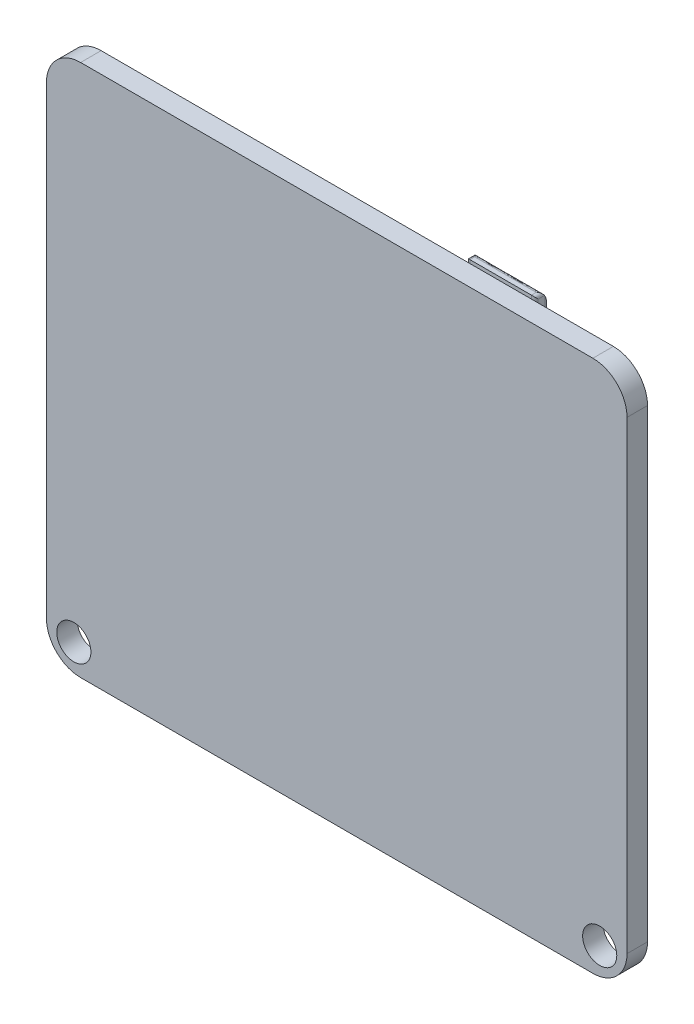
from build123d import *

# Parameters (mm, degrees)
SKETCH2_W           = 85
SKETCH2_H           = 78
BOSS_EXTRUDE2_DEPTH = 3
SKETCH5_R           = 2.5
CUT_EXTRUDE1_DEPTH  = 3
FILLET1_R           = 5
FILLET2_R           = 5
FILLET3_R           = 5
FILLET4_R           = 5
SKETCH12_W          = 10
SKETCH12_H          = 2.5
BOSS_EXTRUDE3_DEPTH = 3
SKETCH14_W          = 10
SKETCH14_H          = 2
BOSS_EXTRUDE4_DEPTH = 1.5
FILLET10_R          = 0.5
FILLET11_START      = 47
FILLET11_DEPTH      = 11


with BuildPart() as part:
    # Sketch2 → Boss-Extrude2 (new body)
    with BuildSketch(Plane.XY):
        with Locations((32.5, -1)):
            Rectangle(SKETCH2_W, SKETCH2_H)
    extrude(amount=BOSS_EXTRUDE2_DEPTH)

    # Sketch5 → Cut-Extrude1 (cut)
    with BuildSketch(Plane.XY):
        with Locations((-6, -36)):
            Circle(SKETCH5_R)
        with Locations((71, -36)):
            Circle(SKETCH5_R)
    extrude(amount=CUT_EXTRUDE1_DEPTH, mode=Mode.SUBTRACT)

    # Fillet1
    fillet1_edges = [part.edges().sort_by_distance(p)[0] for p in [
        (75, -40, 1.5),
    ]]
    fillet(fillet1_edges, radius=FILLET1_R)

    # Fillet2
    fillet2_edges = [part.edges().sort_by_distance(p)[0] for p in [
        (75, 38, 1.5),
    ]]
    fillet(fillet2_edges, radius=FILLET2_R)

    # Fillet3
    fillet3_edges = [part.edges().sort_by_distance(p)[0] for p in [
        (-10, 38, 1.5),
    ]]
    fillet(fillet3_edges, radius=FILLET3_R)

    # Fillet4
    fillet4_edges = [part.edges().sort_by_distance(p)[0] for p in [
        (-10, -40, 1.5),
    ]]
    fillet(fillet4_edges, radius=FILLET4_R)

    # Sketch12 → Boss-Extrude3 (add)
    with BuildSketch(Plane.XY):
        with Locations((52.5, 34.75)):
            Rectangle(SKETCH12_W, SKETCH12_H)
    extrude(amount=-BOSS_EXTRUDE3_DEPTH)

    # Sketch14 → Boss-Extrude4 (add)
    with BuildSketch(Plane(origin=(0, 36, 0), x_dir=(1, 0, 0), z_dir=(0, 1, 0))):
        with Locations((52.5, 2)):
            Rectangle(SKETCH14_W, SKETCH14_H)
    extrude(amount=BOSS_EXTRUDE4_DEPTH)

    # Fillet10
    fillet10_edges = [part.edges().sort_by_distance(p)[0] for p in [
        (57.5, 35.5, -3),
        (52.5, 33.5, -3),
        (57.5, 33.5, -1.5),
        (47.5, 35.5, -3),
        (47.5, 33.5, -1.5),
        (57.5, 34.75, 0),
        (52.5, 36, 0),
        (47.5, 34.75, 0),
        (52.5, 33.5, 0),
        (57.5, 36, -0.5),
        (47.5, 36, -0.5),
        (47.5, 36.75, -1),
        (57.5, 36.75, -1),
        (47.5, 37.5, -2),
        (57.5, 37.5, -2),
    ]]
    fillet(fillet10_edges, radius=FILLET10_R)

    # Fillet11: read off the stored shape, not the designer's step
    # Fillet11 outline → Fillet11 (cut)
    with BuildSketch(Plane.YZ.offset(FILLET11_START)):
        with BuildLine():
            add(Edge.make_bspline(
                [(34.5, -3), (37.5, -3), (37.5, -1.7)],
                knots=[0, 0, 0, 1, 1, 1], degree=2, weights=[1, 0.707106781, 1]))
            Line((34.5, -3), (37.5, -3))
            Line((37.5, -3), (37.5, -1.7))
        make_face()
    extrude(amount=FILLET11_DEPTH, mode=Mode.SUBTRACT)


solid = part.part
